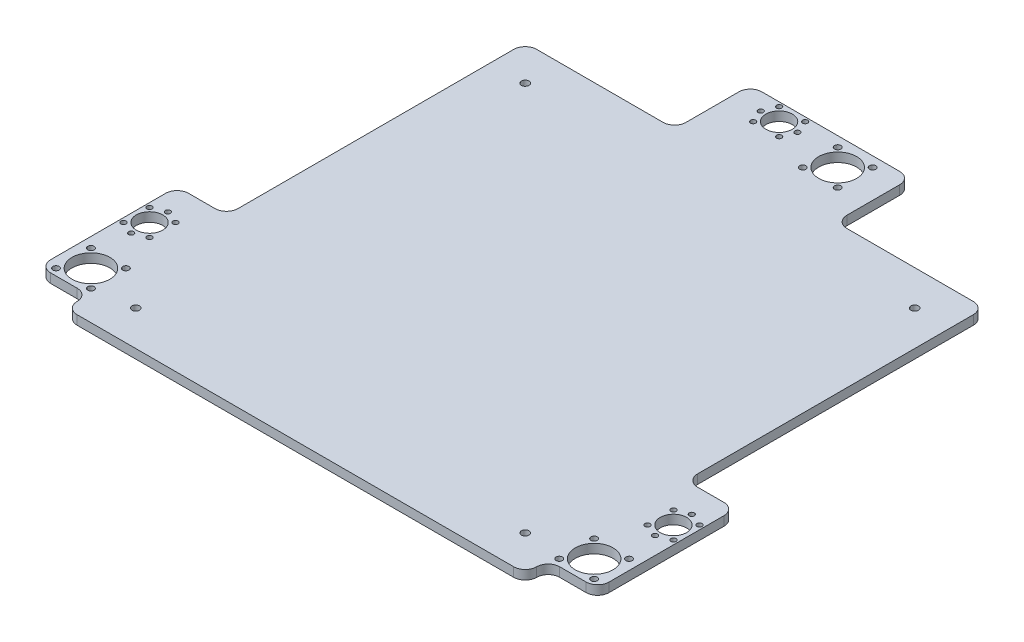
from build123d import *

# Parameters (mm, degrees)
SKETCH2_W            = 486
SKETCH2_H            = 446
BOSS_EXTRUDE1_DEPTH  = 8
M5_CLEARANCE_HOLE1_D = 5.5
M4_CLEARANCE_HOLE1_D = 4.5
SKETCH8_R            = 11.5
SKETCH8_R_2          = 16.5
CUT_EXTRUDE1_DEPTH   = 346.874254607
M5_CLEARANCE_HOLE2_D = 5.5
M4_CLEARANCE_HOLE2_D = 4.5
SKETCH13_R           = 11.5
SKETCH13_R_2         = 16.5
CUT_EXTRUDE2_DEPTH   = 346.874254607
CUT_EXTRUDE5_DEPTH   = 346.874254607
SKETCH20_W           = 400
SKETCH20_H           = 400
BOSS_EXTRUDE2_DEPTH  = 8
FILLET3_R            = 10
M6_CLEARANCE_HOLE1_D = 6.6


with BuildPart() as part:
    # Sketch2 → Boss-Extrude1 (new body)
    with BuildSketch(Plane(origin=(0, 0, 0), x_dir=(1, 0, 0), z_dir=(0, 1, 0))):
        with Locations((0, 23)):
            Rectangle(SKETCH2_W, SKETCH2_H)
    extrude(amount=BOSS_EXTRUDE1_DEPTH)

    # M5 Clearance Hole1 (through all)
    with Locations(Plane(origin=(0, 8, 0), x_dir=(1, 0, 0), z_dir=(0, 1, 0))):
        with Locations((-234.202795796, -163.797204204), (-203.797204204, -163.797204204), (-203.797204204, -194.202795796), (-234.202795796, -194.202795796)):
            m5_clearance_hole1 = Hole(M5_CLEARANCE_HOLE1_D / 2)

    # M4 Clearance Hole1 (through all)
    with Locations(Plane(origin=(0, 8, 0), x_dir=(1, 0, 0), z_dir=(0, 1, 0))):
        with Locations((-228, -135), (-216.686291501, -130.313708499), (-216.686291501, -107.686291501), (-228, -103), (-239.313708499, -107.686291501), (-239.313708499, -130.313708499)):
            m4_clearance_hole1 = Hole(M4_CLEARANCE_HOLE1_D / 2)

    # Sketch8 → Cut-Extrude1 (cut, through all)
    with BuildSketch(Plane(origin=(0, 8, 0), x_dir=(1, 0, 0), z_dir=(0, 1, 0))):
        with Locations(Location((-228, -119, 0), (0, 0, 270))):
            Circle(SKETCH8_R)
        with Locations(Location((-219, -179, 0), (0, 0, 270))):
            Circle(SKETCH8_R_2)
    cut_extrude1 = extrude(amount=-CUT_EXTRUDE1_DEPTH, mode=Mode.SUBTRACT)

    # Mirror1: M5 Clearance Hole1, M4 Clearance Hole1, Cut-Extrude1 across plane
    add(m5_clearance_hole1.mirror(Plane(origin=(0, 0, 0), x_dir=(0, 0, 1), z_dir=(1, 0, 0))), mode=Mode.SUBTRACT)
    add(m4_clearance_hole1.mirror(Plane(origin=(0, 0, 0), x_dir=(0, 0, 1), z_dir=(1, 0, 0))), mode=Mode.SUBTRACT)
    add(cut_extrude1.mirror(Plane(origin=(0, 0, 0), x_dir=(0, 0, 1), z_dir=(1, 0, 0))), mode=Mode.SUBTRACT)

    # M5 Clearance Hole2 (through all)
    with Locations(Plane(origin=(0, 8, 0), x_dir=(1, 0, 0), z_dir=(0, 1, 0))):
        with Locations((45.202795796, 206.797204204), (14.797204204, 206.797204204), (14.797204204, 237.202795796), (45.202795796, 237.202795796)):
            Hole(M5_CLEARANCE_HOLE2_D / 2)

    # M4 Clearance Hole2 (through all)
    with Locations(Plane(origin=(0, 8, 0), x_dir=(1, 0, 0), z_dir=(0, 1, 0))):
        with Locations((-41.313708499, 219.686291501), (-46, 231), (-41.313708499, 242.313708499), (-18.686291501, 242.313708499), (-14, 231), (-18.686291501, 219.686291501)):
            Hole(M4_CLEARANCE_HOLE2_D / 2)

    # Sketch13 → Cut-Extrude2 (cut, through all)
    with BuildSketch(Plane(origin=(0, 8, 0), x_dir=(1, 0, 0), z_dir=(0, 1, 0))):
        with Locations(Location((-30, 231, 0), (0, 0, 270))):
            Circle(SKETCH13_R)
        with Locations(Location((30, 222, 0), (0, 0, 270))):
            Circle(SKETCH13_R_2)
    extrude(amount=-CUT_EXTRUDE2_DEPTH, mode=Mode.SUBTRACT)

    # Sketch19 → Cut-Extrude5 (cut, through all)
    with BuildSketch(Plane(origin=(0, 8, 0), x_dir=(1, 0, 0), z_dir=(0, 1, 0))):
        Polygon((-243, -80), (-200, -80), (-200, 180), (-70, 180), (-70, 246), (-243, 246), align=None)
    cut_extrude5 = extrude(amount=-CUT_EXTRUDE5_DEPTH, mode=Mode.SUBTRACT)

    # Mirror2: Cut-Extrude5 across plane
    add(cut_extrude5.mirror(Plane(origin=(0, 0, 0), x_dir=(0, 0, 1), z_dir=(1, 0, 0))), mode=Mode.SUBTRACT)

    # Sketch20 → Boss-Extrude2 (add)
    with BuildSketch(Plane(origin=(0, 8, 0), x_dir=(1, 0, 0), z_dir=(0, 1, 0))):
        with Locations((0, -20)):
            Rectangle(SKETCH20_W, SKETCH20_H)
    extrude(amount=-BOSS_EXTRUDE2_DEPTH)

    # Fillet3
    fillet3_edges = [part.edges().sort_by_distance(p)[0] for p in [
        (-243, 4, 80),
        (-70, 4, -246),
        (-70, 4, -180),
        (-200, 4, -180),
        (-200, 4, 80),
        (243, 4, 80),
        (200, 4, 80),
        (200, 4, -180),
        (70, 4, -180),
        (70, 4, -246),
        (-200, 4, 220),
        (200, 4, 200),
        (-200, 4, 200),
        (200, 4, 220),
        (243, 4, 200),
        (-243, 4, 200),
    ]]
    fillet(fillet3_edges, radius=FILLET3_R - 0.0001)  # a hair under: the kernel refuses the full size

    # M6 Clearance Hole1 (through all)
    with Locations(Plane(origin=(0, 8, 0), x_dir=(1, 0, 0), z_dir=(0, 1, 0))):
        with Locations((-169.5, -189.5), (-169.5, 149.5), (169.5, 149.5), (169.5, -189.5)):
            Hole(M6_CLEARANCE_HOLE1_D / 2)


solid = part.part
